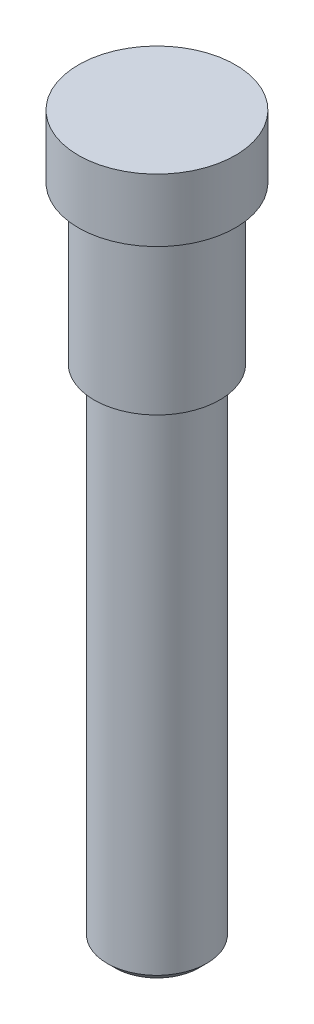
from build123d import *

# Parameters (mm, degrees)
CHAMFER5_SIZE = 0.5


with BuildPart() as part:
    # Sketch1 → Revolve1 (revolve)
    with BuildSketch(Plane.XY):
        Polygon((0, -16), (-3.175, -16), (-3.175, 16), (-4, 16), (-4, 26), (-5, 26), (-5, 30), (0, 30), (0, 18.825290935), align=None)
    revolve(axis=Axis((0, 55, 0), (0, -1, 0)))

    # Chamfer5
    chamfer5_edges = [part.edges().sort_by_distance(p)[0] for p in [
        (3.175, -16, 0),
    ]]
    chamfer(chamfer5_edges, length=CHAMFER5_SIZE)


solid = part.part
